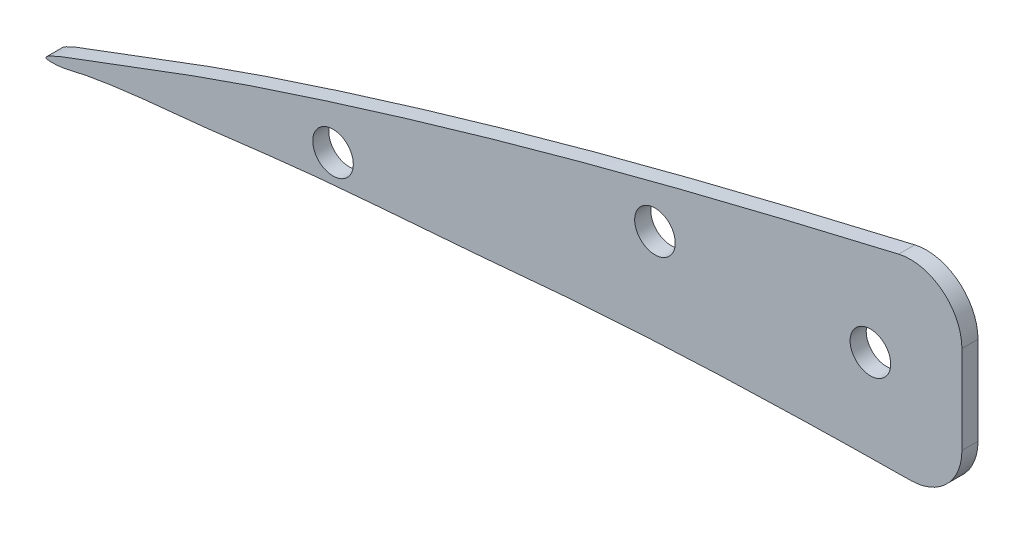
from build123d import *

# Parameters (mm, degrees)
BOSS_EXTRUDE1_DEPTH     = 226.06
CUT_EXTRUDE1_DEPTH      = 248.603669875
CUT_EXTRUDE1_DEPTH_BACK = 248.603669875
FILLET1_R               = 5.08
SKETCH4_W               = 41.117340127
SKETCH4_H               = 67.644656338
SKETCH4_W_2             = 211.282523513
SKETCH4_H_2             = 81.730555137
CUT_EXTRUDE5_DEPTH      = 246.233624371
SKETCH3_R               = 2
CUT_EXTRUDE2_DEPTH      = 220.17283623
SKETCH5_R               = 2
CUT_EXTRUDE6_DEPTH      = 96.073271919


with BuildPart() as part:
    # Sketch1 → Boss-Extrude1 (new body)
    with BuildSketch(Plane.XY):
        with BuildLine():
            Line((99.32639085, 18.404394796), (99.32639085, -2.986448862))
            add(Edge.make_bspline(
                [(5.047603806, -9.653713384), (9.482649657, -8.546128483), (16.988483729, -8.076906091), (30.336595099, -6.254410192), (41.946659702, -5.566037344), (65.865842143, -3.231342143), (83.974811725, -3.089086557), (99.32639085, -2.986448862)],
                knots=[0, 0, 0, 0, 0.144322392, 0.237947652, 0.42712275, 0.512831912, 1, 1, 1, 1], degree=3))
            add(Edge.make_bspline(
                [(5.047603806, -9.653713384), (1.304537033, -10.042523479), (11.503328192, -6.353494655), (19.723627138, -3.092777487), (52.915151131, 7.645918304), (77.889766355, 13.460013374), (99.32639085, 18.404394796)],
                knots=[0, 0, 0, 0, 0.059914523, 0.175786391, 0.369274689, 1, 1, 1, 1], degree=3))
        make_face()
    extrude(amount=BOSS_EXTRUDE1_DEPTH)

    # Sketch2 → Cut-Extrude1 (cut, two sides: drawn at the far end of the back side and taken through both)
    with BuildSketch(Plane(origin=(0, 0, 0), x_dir=(1, 0, 0), z_dir=(0, 1, 0)).offset(-CUT_EXTRUDE1_DEPTH_BACK)):
        Polygon((169.681502528, 0), (169.681502528, -226.06), (73.16439085, -226.06), (73.16439085, -197.485), (93.73839085, -197.485), (93.73839085, -28.575), (73.16439085, -28.575), (73.16439085, 0), align=None)
    extrude(amount=CUT_EXTRUDE1_DEPTH + CUT_EXTRUDE1_DEPTH_BACK, mode=Mode.SUBTRACT)

    # Fillet1
    fillet1_edges = [part.edges().sort_by_distance(p)[0] for p in [
        (73.16439085, -3.388889971, 14.2875),
        (73.16439085, 12.236004014, 14.2875),
        (93.73839085, -3.026654485, 113.03),
        (93.73839085, 17.113551214, 113.03),
        (73.16439085, -3.388889971, 211.7725),
        (73.16439085, 12.236004014, 211.7725),
    ]]
    fillet(fillet1_edges, radius=FILLET1_R)

    # Sketch4 → Cut-Extrude5 (cut, through all)
    with BuildSketch(Plane(origin=(0, 0, 0), x_dir=(0, 0, -1), z_dir=(1, 0, 0))):
        with Locations((-218.043670064, 8.278534275)):
            Rectangle(SKETCH4_W, SKETCH4_H)
        with Locations((-90.256238244, 1.235584875)):
            Rectangle(SKETCH4_W_2, SKETCH4_H_2)
    extrude(amount=CUT_EXTRUDE5_DEPTH, mode=Mode.SUBTRACT)

    # Sketch3 → Cut-Extrude2 (cut, through all)
    with BuildSketch(Plane.XY):
        with Locations((84.713563037, 5.874854857)):
            Circle(SKETCH3_R)
    extrude(amount=CUT_EXTRUDE2_DEPTH, mode=Mode.SUBTRACT)

    # Sketch5 → Cut-Extrude6 (cut, through all)
    with BuildSketch(Plane.XY.offset(197.485)):
        with Locations((31.717603806, -3.557713384)):
            Circle(SKETCH5_R)
        with Locations((63.467603806, 5.586286616)):
            Circle(SKETCH5_R)
    extrude(amount=-CUT_EXTRUDE6_DEPTH, mode=Mode.SUBTRACT)


solid = part.part
